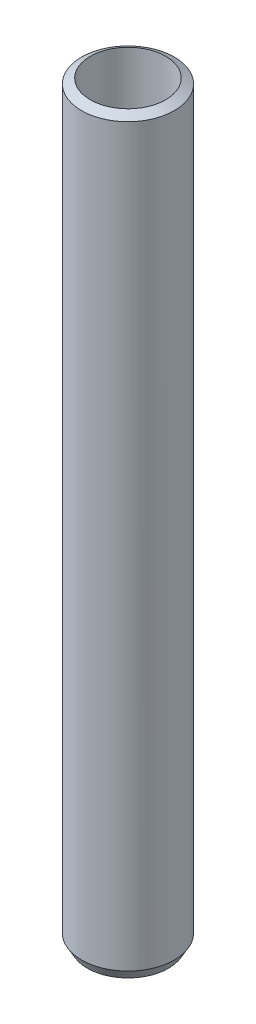
from build123d import *

# Parameters (mm, degrees)
SKETCH1_R           = 25
BOSS_EXTRUDE1_DEPTH = 404.78488
SKETCH2_R           = 20.312055764
CUT_EXTRUDE1_DEPTH  = 407.325976374
CHAMFER1_SIZE       = 3.144554
CHAMFER1_SIZE_2     = 5.446527


with BuildPart() as part:
    # Sketch1 → Boss-Extrude1 (new body)
    with BuildSketch(Plane(origin=(0, 0, 0), x_dir=(1, 0, 0), z_dir=(0, 1, 0))):
        with Locations(Location((0, 0, 0), (0, 0, 270))):
            Circle(SKETCH1_R)
    extrude(amount=BOSS_EXTRUDE1_DEPTH)

    # Sketch2 → Cut-Extrude1 (cut, through all)
    with BuildSketch(Plane(origin=(0, 0, 0), x_dir=(1, 0, 0), z_dir=(0, 1, 0))):
        with Locations(Location((0, 0, 0), (0, 0, 270))):
            Circle(SKETCH2_R)
    extrude(amount=CUT_EXTRUDE1_DEPTH, mode=Mode.SUBTRACT)

    # Chamfer1
    # the kernel refuses this chamfer: 5.446527, 3.144554 mm, written as the material it takes off along each edge
    with BuildSketch(Plane(origin=(0, 404.78488, 0), x_dir=(0, 0, 1), z_dir=(-1, 0, 0))) as chamfer1_piece_1:
        Polygon((25, -CHAMFER1_SIZE), (25 - CHAMFER1_SIZE_2, 0), (25, 0), align=None)
    revolve(axis=Axis((0, 404.78488, 0), (0, 1, 0)), mode=Mode.SUBTRACT)
    with BuildSketch(Plane(origin=(0, 0, 0), x_dir=(0, 0, 1), z_dir=(-1, 0, 0))) as chamfer1_piece_2:
        Polygon((25, CHAMFER1_SIZE_2), (25 - CHAMFER1_SIZE, 0), (25, 0), align=None)
    revolve(axis=Axis((0, 0, 0), (0, 1, 0)), mode=Mode.SUBTRACT)


solid = part.part
